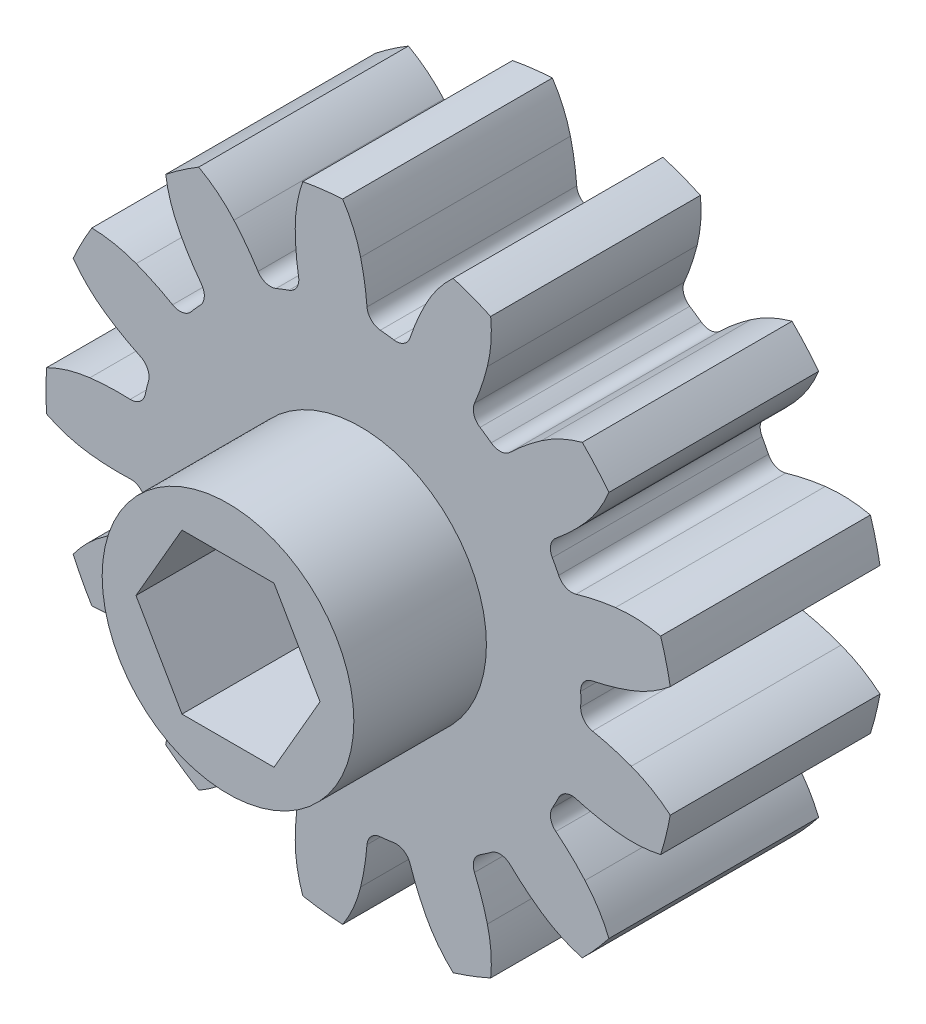
from build123d import *

# Parameters (mm, degrees)
SKETCH1_R           = 9.525
ROUND_STOCK_DEPTH   = 3.175
SINGLE_TOOTH_DEPTH  = 15.892070037
TOOTH_PATTERN_COUNT = 13
CUT_EXTRUDE1_DEPTH  = 15.882187212
SKETCH8_R           = 3.81
BOSS_EXTRUDE1_DEPTH = 4.0132


with BuildPart() as part:
    # Sketch1 → Round Stock (new, symmetric)
    with BuildSketch(Plane.XY):
        Circle(SKETCH1_R)
    extrude(amount=ROUND_STOCK_DEPTH, both=True)

    # Sketch2 → Single Tooth (cut, through all)
    with BuildSketch(Plane.XY.offset(3.175)):
        with BuildLine():
            ThreePointArc((-8.699219347, -3.879330837), (-9.248220811, -2.279481702), (-9.505591122, -0.607751944))
            ThreePointArc((-9.505591122, -0.607751944), (-8.866874127, -0.859264513), (-8.194501154, -0.997585))
            ThreePointArc((-8.194501154, -0.997585), (-7.585039492, -1.044554082), (-6.973773022, -1.042846396))
            ThreePointArc((-6.973773022, -1.042846396), (-6.682727126, -1.135452938), (-6.520145475, -1.394008333))
            ThreePointArc((-6.520145475, -1.394008333), (-6.473754568, -1.595637192), (-6.421130074, -1.795729609))
            ThreePointArc((-6.421130074, -1.795729609), (-6.444932293, -2.100224502), (-6.659604229, -2.317479295))
            ThreePointArc((-6.659604229, -2.317479295), (-7.201647409, -2.600036906), (-7.71947129, -2.92485692))
            ThreePointArc((-7.71947129, -2.92485692), (-8.250547255, -3.35980093), (-8.699219347, -3.879330837))
        make_face()
    single_tooth = extrude(amount=-SINGLE_TOOTH_DEPTH, mode=Mode.SUBTRACT)

    # Tooth Pattern: Single Tooth ×13 about axis
    tooth_pattern_axis = Axis((0, 0, 50), (0, 0, -1))
    for i in range(1, TOOTH_PATTERN_COUNT):
        add(single_tooth.rotate(tooth_pattern_axis, i * 360 / TOOTH_PATTERN_COUNT), mode=Mode.SUBTRACT)

    # Sketch7 → Cut-Extrude1 (cut, through all)
    with BuildSketch(Plane(origin=(0, 0, -3.175), x_dir=(-1, 0, 0), z_dir=(0, 0, -1))):
        Polygon((1.3931462, -2.413), (2.786292399, 0), (1.3931462, 2.413), (-1.3931462, 2.413), (-2.786292399, 0), (-1.3931462, -2.413), align=None)
    extrude(amount=-CUT_EXTRUDE1_DEPTH, mode=Mode.SUBTRACT)

    # Sketch8 → Boss-Extrude1 (add)
    with BuildSketch(Plane.XY.offset(3.175)):
        Circle(SKETCH8_R)
        Polygon((-1.3931462, -2.413), (1.3931462, -2.413), (2.786292399, 0), (1.3931462, 2.413), (-1.3931462, 2.413), (-2.786292399, 0), align=None, mode=Mode.SUBTRACT)
    extrude(amount=BOSS_EXTRUDE1_DEPTH)


solid = part.part
